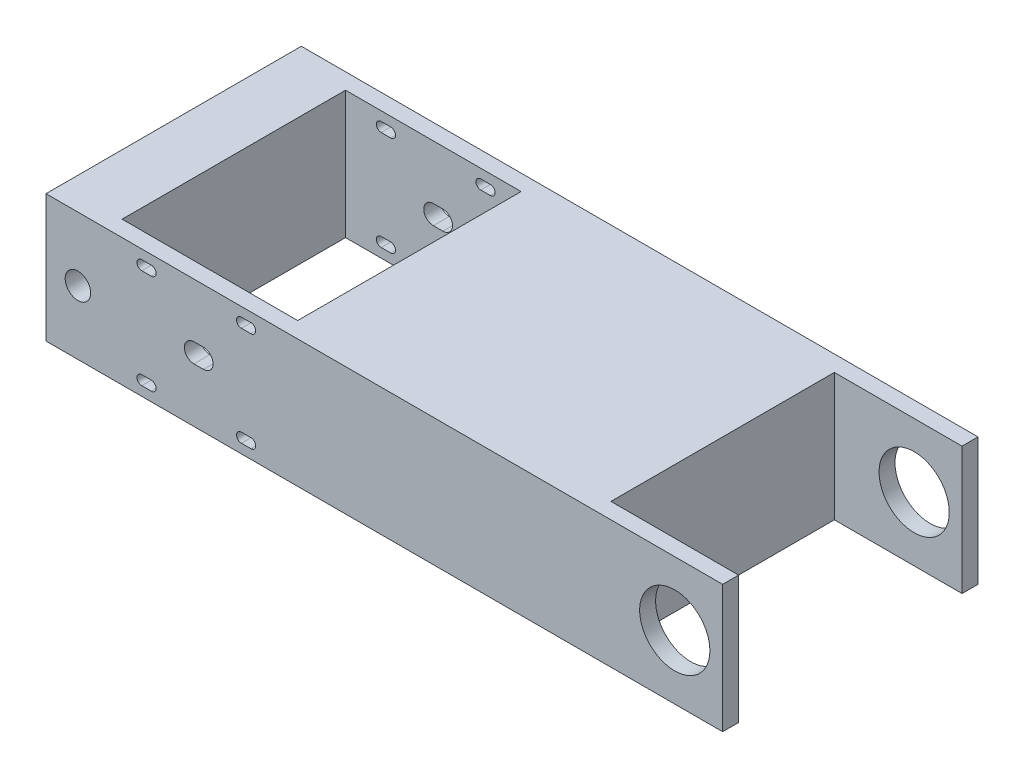
from build123d import *

# Parameters (mm, degrees)
SKETCH1_W               = 212
SKETCH1_H               = 40
SKETCH1_R               = 4
SKETCH1_R_2             = 11
BOSS_EXTRUDE1_DEPTH     = 40
CUT_EXTRUDE3_DEPTH      = 116.047816146
CUT_EXTRUDE3_DEPTH_BACK = 116.047816146
SKETCH2_W               = 55
SKETCH2_H               = 70
SKETCH2_W_2             = 40


with BuildPart() as part:
    # Sketch1 → Boss-Extrude1 (new, symmetric)
    with BuildSketch(Plane.XY):
        Rectangle(SKETCH1_W, SKETCH1_H)
        with BuildLine():
            ThreePointArc((-76, -17.1), (-77.5, -15.6), (-76, -14.1))
            Line((-76, -14.1), (-73, -14.1))
            ThreePointArc((-73, -14.1), (-71.5, -15.6), (-73, -17.1))
            Line((-73, -17.1), (-76, -17.1))
        make_face(mode=Mode.SUBTRACT)
        with BuildLine():
            ThreePointArc((-44.8, -17.1), (-46.3, -15.6), (-44.8, -14.1))
            Line((-44.8, -14.1), (-41.8, -14.1))
            ThreePointArc((-41.8, -14.1), (-40.3, -15.6), (-41.8, -17.1))
            Line((-41.8, -17.1), (-44.8, -17.1))
        make_face(mode=Mode.SUBTRACT)
        with Locations((-96, 0)):
            Circle(SKETCH1_R, mode=Mode.SUBTRACT)
        with BuildLine():
            ThreePointArc((-59.65, -3), (-62.65, 0), (-59.65, 3))
            Line((-59.65, 3), (-56.65, 3))
            ThreePointArc((-56.65, 3), (-53.65, 0), (-56.65, -3))
            Line((-56.65, -3), (-59.65, -3))
        make_face(mode=Mode.SUBTRACT)
        with BuildLine():
            ThreePointArc((-73, 17.1), (-71.939339828, 16.660660172), (-71.5, 15.6))
            ThreePointArc((-71.5, 15.6), (-71.939339828, 14.539339828), (-73, 14.1))
            Line((-73, 14.1), (-76, 14.1))
            ThreePointArc((-76, 14.1), (-77.5, 15.6), (-76, 17.1))
            Line((-76, 17.1), (-73, 17.1))
        make_face(mode=Mode.SUBTRACT)
        with BuildLine():
            ThreePointArc((-44.8, 14.1), (-45.860660172, 14.539339828), (-46.3, 15.6))
            ThreePointArc((-46.3, 15.6), (-45.860660172, 16.660660172), (-44.8, 17.1))
            Line((-44.8, 17.1), (-41.8, 17.1))
            ThreePointArc((-41.8, 17.1), (-40.3, 15.6), (-41.8, 14.1))
            Line((-41.8, 14.1), (-44.8, 14.1))
        make_face(mode=Mode.SUBTRACT)
        with Locations((91, 0)):
            Circle(SKETCH1_R_2, mode=Mode.SUBTRACT)
    extrude(amount=BOSS_EXTRUDE1_DEPTH, both=True)

    # Sketch2 → Cut-Extrude3 (cut, two sides: drawn at the far end of the back side and taken through both)
    with BuildSketch(Plane(origin=(0, 0, 0), x_dir=(1, 0, 0), z_dir=(0, 1, 0)).offset(-CUT_EXTRUDE3_DEPTH_BACK)):
        with Locations((-59.65, 0)):
            Rectangle(SKETCH2_W, SKETCH2_H)
        with Locations((86, 0)):
            Rectangle(SKETCH2_W_2, SKETCH2_H)
    extrude(amount=CUT_EXTRUDE3_DEPTH + CUT_EXTRUDE3_DEPTH_BACK, mode=Mode.SUBTRACT)


solid = part.part
